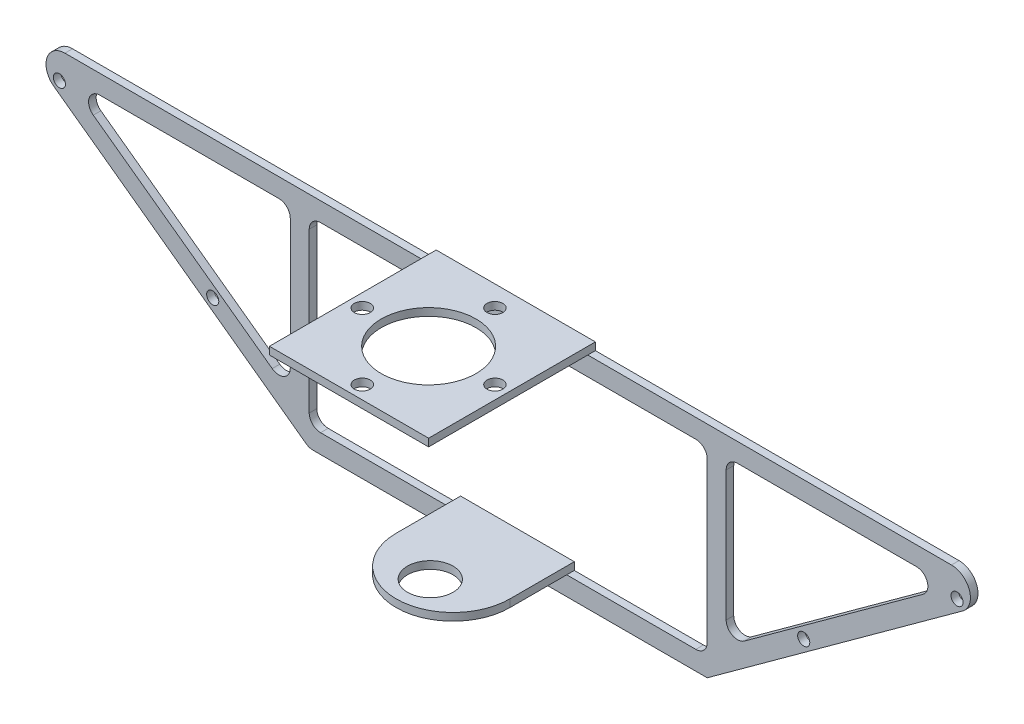
from build123d import *

# Parameters (mm, degrees)
SKETCH_1_R                      = 1.6
SKETCH_1_W                      = 105
SKETCH_1_H                      = 48
EXTRUDE_1_DEPTH                 = 2
FILLET_1_R                      = 3
SKETCH_2_W                      = 30
SKETCH_2_H                      = 2
EXTRUDE_2_DEPTH                 = 32
CUT_EXTRUDE_START               = -2
CUT_EXTRUDE_1_OUTLINE_R         = 6
CUT_EXTRUDE_1_DEPTH             = 2
SKETCH_4_W                      = 42
SKETCH_4_H                      = 2
EXTRUDE_3_DEPTH                 = 44
CUT_EXTRUDE_2_REACH             = 144.849
SKETCH_5_R                      = 2.1
SKETCH_5_R_2                    = 12.5
CUT_EXTRUDE_2_DIRECTION_2_DEPTH = 143.84882365


# Read off the part's stored shape, not the designer's step: ｶｯﾄ - 押し出し1
with BuildPart() as part:
    # ｽｹｯﾁ1 → ﾎﾞｽ - 押し出し1 (new body)
    with BuildSketch(Plane.XY):
        with BuildLine():
            Line((-116.941733701, 29), (116.941733701, 29))
            ThreePointArc((116.941733701, 29), (121.697016283, 25.545084972), (119.880659963, 19.954915028))
            Line((119.880659963, 19.954915028), (52.5, -29))
            Line((52.5, -29), (-52.5, -29))
            Line((-52.5, -29), (-119.880659963, 19.954915028))
            ThreePointArc((-119.880659963, 19.954915028), (-121.697016283, 25.545084972), (-116.941733701, 29))
        make_face()
        with Locations((118.411196832, 21.977457514)):
            Circle(SKETCH_1_R, mode=Mode.SUBTRACT)
        with Locations((77.960347113, -7.411805101)):
            Circle(SKETCH_1_R, mode=Mode.SUBTRACT)
        with Locations(Location((-118.411196832, 21.977457514, 0), (0, 0, 180))):
            Circle(SKETCH_1_R, mode=Mode.SUBTRACT)
        with Locations(Location((-77.960347113, -7.411805101, 0), (0, 0, 180))):
            Circle(SKETCH_1_R, mode=Mode.SUBTRACT)
        Rectangle(SKETCH_1_W, SKETCH_1_H, mode=Mode.SUBTRACT)
        with BuildLine():
            Line((-57.5, 21), (-57.5, -13.299115956))
            ThreePointArc((-57.5, -13.299115956), (-59.138028501, -15.972135529), (-62.263355757, -15.726166939))
            Line((-62.263355757, -15.726166939), (-116.941733701, 24))
            Line((-116.941733701, 24), (-60.5, 24))
            ThreePointArc((-60.5, 24), (-58.378679656, 23.121320344), (-57.5, 21))
        make_face(mode=Mode.SUBTRACT)
        with BuildLine():
            Line((62.263355757, -15.726166939), (116.941733701, 24))
            Line((116.941733701, 24), (60.5, 24))
            ThreePointArc((60.5, 24), (58.378679656, 23.121320344), (57.5, 21))
            Line((57.5, 21), (57.5, -13.299115956))
            ThreePointArc((57.5, -13.299115956), (59.138028501, -15.972135529), (62.263355757, -15.726166939))
        make_face(mode=Mode.SUBTRACT)
    extrude(amount=EXTRUDE_1_DEPTH)

    # ﾌｨﾚｯﾄ1
    fillet_1_edges = [part.edges().sort_by_distance(p)[0] for p in [
        (-52.5, -29, 1),
        (-52.5, 24, 1),
        (-52.5, -24, 1),
        (52.5, -24, 1),
        (52.5, 24, 1),
        (116.941733701, 24, 1),
        (-116.941733701, 24, 1),
    ]]
    fillet(fillet_1_edges, radius=FILLET_1_R)

    # ｽｹｯﾁ2 → ﾎﾞｽ - 押し出し2 (add)
    with BuildSketch(Plane(origin=(0, 0, 0), x_dir=(-1, 0, 0), z_dir=(0, 0, -1))):
        with Locations((-0.436960971, -23)):
            Rectangle(SKETCH_2_W, SKETCH_2_H)
    extrude(amount=-EXTRUDE_2_DEPTH)

    # ｶｯﾄ - 押し出し1 outline → ｶｯﾄ - 押し出し1 (cut)
    with BuildSketch(Plane.XZ.offset(24).offset(CUT_EXTRUDE_START)):
        with BuildLine():
            ThreePointArc((-14.563039029, 17), (-10.169640747, 27.606601718), (0.436960971, 32))
            Line((0.436960971, 32), (-14.563039029, 32))
            Line((-14.563039029, 32), (-14.563039029, 17))
        make_face()
        with BuildLine():
            ThreePointArc((0.436960971, 32), (11.043562689, 27.606601718), (15.436960971, 17))
            Line((15.436960971, 17), (15.436960971, 32))
            Line((15.436960971, 32), (0.436960971, 32))
        make_face()
        with Locations((0.436960971, 23)):
            Circle(CUT_EXTRUDE_1_OUTLINE_R)
    extrude(amount=CUT_EXTRUDE_1_DEPTH, mode=Mode.SUBTRACT)

    # ｽｹｯﾁ4 → ﾎﾞｽ - 押し出し3 (add)
    with BuildSketch(Plane(origin=(0, 0, 0), x_dir=(-1, 0, 0), z_dir=(0, 0, -1))):
        with Locations((0, 30)):
            Rectangle(SKETCH_4_W, SKETCH_4_H)
    extrude(amount=-EXTRUDE_3_DEPTH)

    # ｽｹｯﾁ5 → ｶｯﾄ - 押し出し2 (cut, up to next)
    with BuildSketch(Plane(origin=(0, 31, 0), x_dir=(1, 0, 0), z_dir=(0, 1, 0)), mode=Mode.PRIVATE) as cut_extrude_2_sk1:
        with Locations(Location((0, -5.5, 0), (0, 0, 90))):
            Circle(SKETCH_5_R)
    cut_extrude_2_tool1 = extrude(cut_extrude_2_sk1.sketch, amount=-CUT_EXTRUDE_2_REACH, mode=Mode.PRIVATE) & part.part
    # ｽｹｯﾁ5 → ｶｯﾄ - 押し出し2 (cut, up to next)
    with BuildSketch(Plane(origin=(0, 31, 0), x_dir=(1, 0, 0), z_dir=(0, 1, 0)), mode=Mode.PRIVATE) as cut_extrude_2_sk2:
        with Locations(Location((-17.5, -23, 0), (0, 0, 90))):
            Circle(SKETCH_5_R)
    cut_extrude_2_tool2 = extrude(cut_extrude_2_sk2.sketch, amount=-CUT_EXTRUDE_2_REACH, mode=Mode.PRIVATE) & part.part
    # ｽｹｯﾁ5 → ｶｯﾄ - 押し出し2 (cut, up to next)
    with BuildSketch(Plane(origin=(0, 31, 0), x_dir=(1, 0, 0), z_dir=(0, 1, 0)), mode=Mode.PRIVATE) as cut_extrude_2_sk3:
        with Locations(Location((0, -40.5, 0), (0, 0, 90))):
            Circle(SKETCH_5_R)
    cut_extrude_2_tool3 = extrude(cut_extrude_2_sk3.sketch, amount=-CUT_EXTRUDE_2_REACH, mode=Mode.PRIVATE) & part.part
    # ｽｹｯﾁ5 → ｶｯﾄ - 押し出し2 (cut, up to next)
    with BuildSketch(Plane(origin=(0, 31, 0), x_dir=(1, 0, 0), z_dir=(0, 1, 0)), mode=Mode.PRIVATE) as cut_extrude_2_sk4:
        with Locations(Location((17.5, -23, 0), (0, 0, 90))):
            Circle(SKETCH_5_R)
    cut_extrude_2_tool4 = extrude(cut_extrude_2_sk4.sketch, amount=-CUT_EXTRUDE_2_REACH, mode=Mode.PRIVATE) & part.part
    # ｽｹｯﾁ5 → ｶｯﾄ - 押し出し2 (cut, up to next)
    with BuildSketch(Plane(origin=(0, 31, 0), x_dir=(1, 0, 0), z_dir=(0, 1, 0)), mode=Mode.PRIVATE) as cut_extrude_2_sk5:
        with Locations(Location((0, -23, 0), (0, 0, 90))):
            Circle(SKETCH_5_R_2)
    cut_extrude_2_tool5 = extrude(cut_extrude_2_sk5.sketch, amount=-CUT_EXTRUDE_2_REACH, mode=Mode.PRIVATE) & part.part
    add(cut_extrude_2_tool1.solids().sort_by_distance((0, 31, 5.5))[0], mode=Mode.SUBTRACT)
    add(cut_extrude_2_tool2.solids().sort_by_distance((-17.5, 31, 23))[0], mode=Mode.SUBTRACT)
    add(cut_extrude_2_tool3.solids().sort_by_distance((0, 31, 40.5))[0], mode=Mode.SUBTRACT)
    add(cut_extrude_2_tool4.solids().sort_by_distance((17.5, 31, 23))[0], mode=Mode.SUBTRACT)
    add(cut_extrude_2_tool5.solids().sort_by_distance((0, 31, 23))[0], mode=Mode.SUBTRACT)

    # ｽｹｯﾁ5 → ｶｯﾄ - 押し出し2 direction 2 (cut)
    with BuildSketch(Plane(origin=(0, 31, 0), x_dir=(1, 0, 0), z_dir=(0, 1, 0))):
        with Locations(Location((0, -5.5, 0), (0, 0, 90))):
            Circle(SKETCH_5_R)
        with Locations(Location((-17.5, -23, 0), (0, 0, 90))):
            Circle(SKETCH_5_R)
        with Locations(Location((0, -40.5, 0), (0, 0, 90))):
            Circle(SKETCH_5_R)
        with Locations(Location((17.5, -23, 0), (0, 0, 90))):
            Circle(SKETCH_5_R)
        with Locations(Location((0, -23, 0), (0, 0, 90))):
            Circle(SKETCH_5_R_2)
    extrude(amount=CUT_EXTRUDE_2_DIRECTION_2_DEPTH, mode=Mode.SUBTRACT)


solid = part.part
